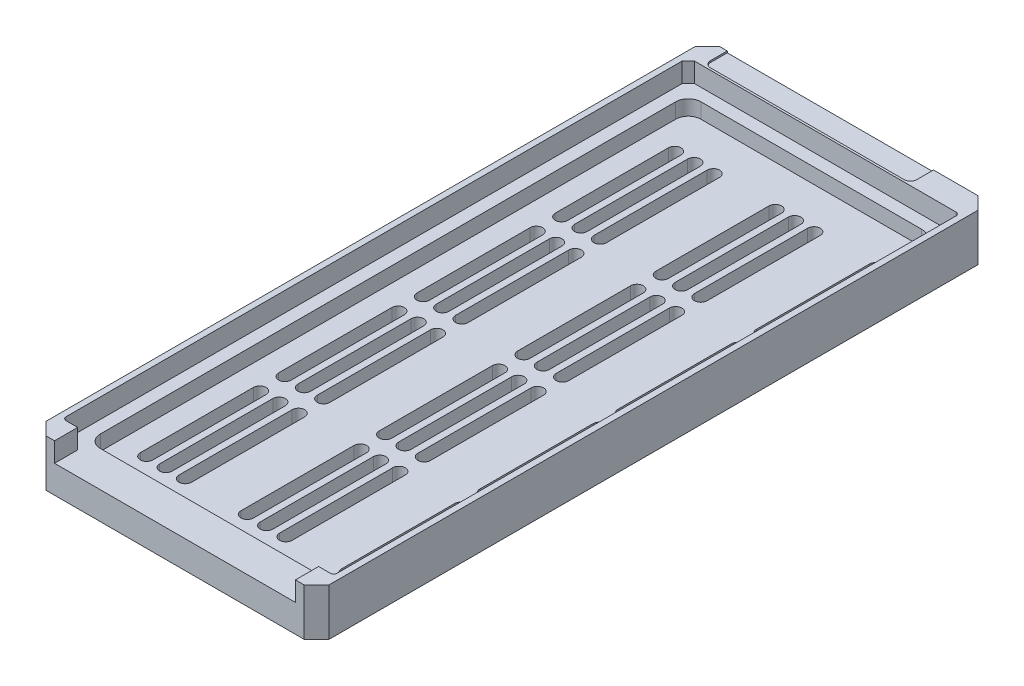
from build123d import *

# Parameters (mm, degrees)
SKETCH3_W                       = 143.002
SKETCH3_H                       = 340.36
BOSS_EXTRUDE1_DEPTH             = 23.8252
CUT_EXTRUDE1_DEPTH              = 9.8552
MOVE_FACE1_BY                   = 1.016
SKETCH5_W                       = 124.206
SKETCH5_H                       = 303.276
CUT_EXTRUDE2_DEPTH              = 7.62
CUT_EXTRUDE4_DEPTH              = 0.8382
FILLET1_R                       = 6.35
FILLET2_R                       = 1.778
SKETCH8_W                       = 121.666
SKETCH8_H                       = 11.684
CUT_EXTRUDE3_DEPTH              = 9.8552
F_1_4_0_25_DIAMETER_SLOT1_DEPTH = 6.35
LPATTERN1_COUNT                 = 4
LPATTERN1_PITCH                 = 69.85
CHAMFER1_SIZE                   = 6.35


# Read off the part's stored shape, not the designer's step: 1/4 (0.25) Diameter Slot1
with BuildPart() as part:
    # Sketch3 → Boss-Extrude1 (new body)
    with BuildSketch(Plane(origin=(0, 0, 0), x_dir=(1, 0, 0), z_dir=(0, 1, 0))):
        with Locations((124.46762, -393.570370634)):
            Rectangle(SKETCH3_W, SKETCH3_H)
    extrude(amount=BOSS_EXTRUDE1_DEPTH)

    # Sketch4 → Cut-Extrude1 (cut)
    with BuildSketch(Plane(origin=(0, 23.8252, 0), x_dir=(1, 0, 0), z_dir=(0, 1, 0))):
        Polygon((192.92062, -236.090370634), (192.92062, -551.050370634), (56.01462, -551.050370634), (56.01462, -239.265370634), (59.18962, -236.090370634), align=None)
    extrude(amount=-CUT_EXTRUDE1_DEPTH, mode=Mode.SUBTRACT)

    # Move Face1: a face moved inward by 1.016
    extrude(part.faces().sort_by_distance((124.46762, 18.8976, 551.050370634))[0], amount=MOVE_FACE1_BY, dir=(0, 0, 1), mode=Mode.SUBTRACT)

    # Sketch5 → Cut-Extrude2 (cut)
    with BuildSketch(Plane(origin=(0, 13.97, 0), x_dir=(1, 0, 0), z_dir=(0, 1, 0))):
        with Locations((124.46762, -394.078370634)):
            Rectangle(SKETCH5_W, SKETCH5_H)
    extrude(amount=-CUT_EXTRUDE2_DEPTH, mode=Mode.SUBTRACT)

    # Sketch9 → Cut-Extrude4 (cut)
    with BuildSketch(Plane(origin=(0, 23.8252, 0), x_dir=(1, 0, 0), z_dir=(0, 1, 0))):
        with BuildLine():
            Line((66.17462, -235.023570634), (163.96462, -235.023570634))
            ThreePointArc((163.96462, -235.023570634), (166.20968403, -234.093634665), (167.13962, -231.848570634))
            Line((167.13962, -231.848570634), (167.13962, -223.390370634))
            Line((167.13962, -223.390370634), (62.99962, -223.390370634))
            Line((62.99962, -223.390370634), (62.99962, -231.848570634))
            ThreePointArc((62.99962, -231.848570634), (63.92955597, -234.093634665), (66.17462, -235.023570634))
        make_face()
    extrude(amount=-CUT_EXTRUDE4_DEPTH, mode=Mode.SUBTRACT)

    # Fillet1
    fillet1_edges = [part.edges().sort_by_distance(p)[0] for p in [
        (62.36462, 10.16, 545.716370634),
        (62.36462, 10.16, 242.440370634),
        (186.57062, 10.16, 242.440370634),
        (186.57062, 10.16, 545.716370634),
    ]]
    fillet(fillet1_edges, radius=FILLET1_R)

    # Fillet2
    fillet2_edges = [part.edges().sort_by_distance(p)[0] for p in [
        (192.92062, 18.8976, 236.090370634),
        (192.92062, 18.8976, 552.066370634),
        (56.01462, 18.8976, 552.066370634),
    ]]
    fillet(fillet2_edges, radius=FILLET2_R)

    # Sketch8 → Cut-Extrude3 (cut)
    with BuildSketch(Plane(origin=(0, 23.8252, 0), x_dir=(1, 0, 0), z_dir=(0, 1, 0))):
        with Locations((124.46762, -557.908370634)):
            Rectangle(SKETCH8_W, SKETCH8_H)
    extrude(amount=-CUT_EXTRUDE3_DEPTH, mode=Mode.SUBTRACT)

    # 1/4 (0.25) Diameter Slot1 outline → 1/4 (0.25) Diameter Slot1 (cut)
    with BuildSketch(Plane(origin=(0, 0, 0), x_dir=(1, 0, 0), z_dir=(0, 1, 0))):
        with BuildLine():
            Line((180.975, -529.841370634), (180.975, -472.691370634))
            ThreePointArc((180.975, -472.691370634), (177.8, -469.516370634), (174.625, -472.691370634))
            Line((174.625, -472.691370634), (174.625, -529.841370634))
            ThreePointArc((174.625, -529.841370634), (177.8, -533.016370634), (180.975, -529.841370634))
        make_face()
        with BuildLine():
            Line((149.694620092, -529.841370634), (149.694620092, -472.691370634))
            ThreePointArc((149.694620092, -472.691370634), (146.519620092, -469.516370634), (143.344620092, -472.691370634))
            Line((143.344620092, -472.691370634), (143.344620092, -529.841370634))
            ThreePointArc((143.344620092, -529.841370634), (146.519620092, -533.016370634), (149.694620092, -529.841370634))
        make_face()
        with BuildLine():
            Line((98.894620092, -529.841370634), (98.894620092, -472.691370634))
            ThreePointArc((98.894620092, -472.691370634), (95.719620092, -469.516370634), (92.544620092, -472.691370634))
            Line((92.544620092, -472.691370634), (92.544620092, -529.841370634))
            ThreePointArc((92.544620092, -529.841370634), (95.719620092, -533.016370634), (98.894620092, -529.841370634))
        make_face()
        with BuildLine():
            Line((139.934620054, -529.841370634), (139.934620054, -472.691370634))
            ThreePointArc((139.934620054, -472.691370634), (136.759620054, -469.516370634), (133.584620054, -472.691370634))
            Line((133.584620054, -472.691370634), (133.584620054, -529.841370634))
            ThreePointArc((133.584620054, -529.841370634), (136.759620054, -533.016370634), (139.934620054, -529.841370634))
        make_face()
        with BuildLine():
            Line((89.134620054, -529.841370634), (89.134620054, -472.691370634))
            ThreePointArc((89.134620054, -472.691370634), (85.959620054, -469.516370634), (82.784620054, -472.691370634))
            Line((82.784620054, -472.691370634), (82.784620054, -529.841370634))
            ThreePointArc((82.784620054, -529.841370634), (85.959620054, -533.016370634), (89.134620054, -529.841370634))
        make_face()
        with BuildLine():
            Line((130.175, -529.841370634), (130.175, -472.691370634))
            ThreePointArc((130.175, -472.691370634), (127, -469.516370634), (123.825, -472.691370634))
            Line((123.825, -472.691370634), (123.825, -529.841370634))
            ThreePointArc((123.825, -529.841370634), (127, -533.016370634), (130.175, -529.841370634))
        make_face()
        with BuildLine():
            Line((79.375, -529.841370634), (79.375, -472.691370634))
            ThreePointArc((79.375, -472.691370634), (76.2, -469.516370634), (73.025, -472.691370634))
            Line((73.025, -472.691370634), (73.025, -529.841370634))
            ThreePointArc((73.025, -529.841370634), (76.2, -533.016370634), (79.375, -529.841370634))
        make_face()
    f_1_4_0_25_diameter_slot1 = extrude(amount=F_1_4_0_25_DIAMETER_SLOT1_DEPTH, mode=Mode.SUBTRACT)

    # LPattern1: 1/4 (0.25) Diameter Slot1 ×4
    with Locations(*[(0, 0, -i * LPATTERN1_PITCH) for i in range(1, LPATTERN1_COUNT)]):
        add(f_1_4_0_25_diameter_slot1, mode=Mode.SUBTRACT)

    # Chamfer1
    chamfer1_edges = [part.edges().sort_by_distance(p)[0] for p in [
        (52.96662, 11.9126, 223.390370634),
        (195.96862, 11.9126, 223.390370634),
        (195.96862, 11.9126, 563.750370634),
        (52.96662, 11.9126, 563.750370634),
    ]]
    chamfer(chamfer1_edges, length=CHAMFER1_SIZE)


solid = part.part
